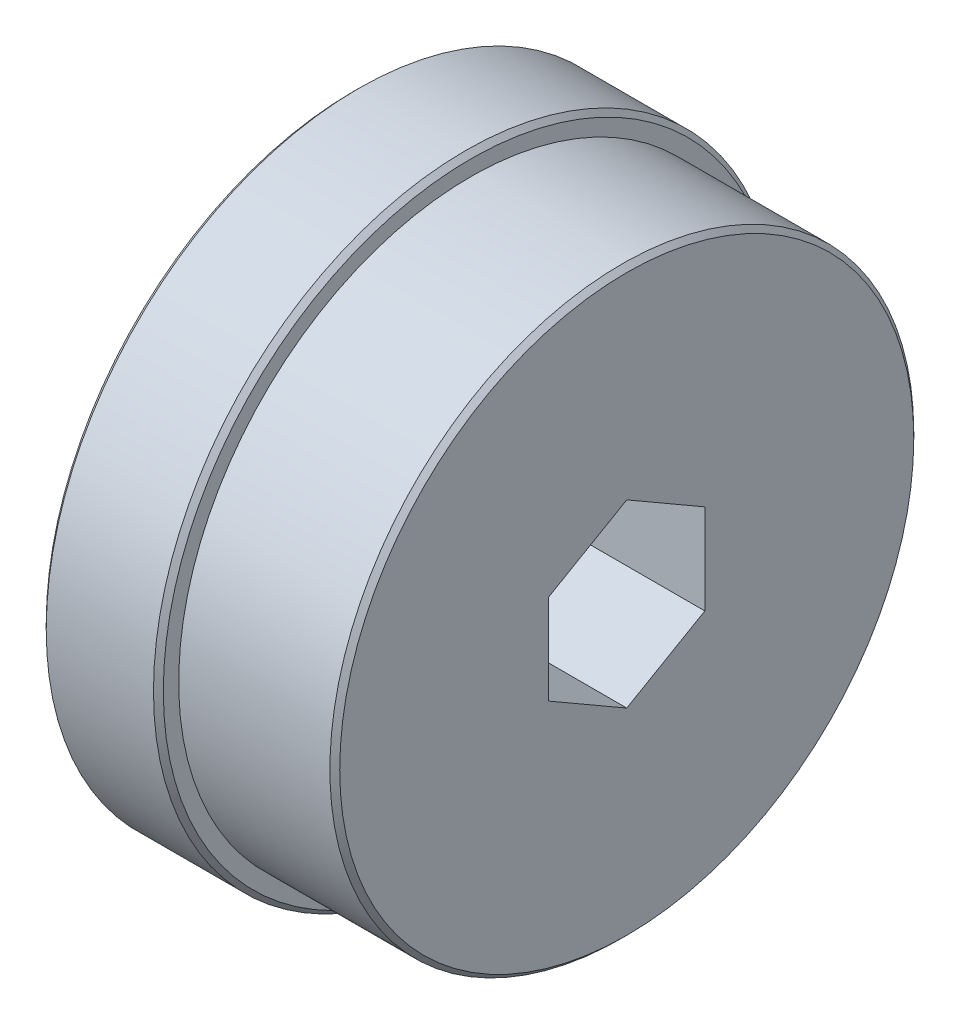
from build123d import *

# Parameters (mm, degrees)
SKETCH1_R           = 23.749
BOSS_EXTRUDE1_DEPTH = 12.7
SKETCH2_R           = 25.4
BOSS_EXTRUDE2_DEPTH = 9.525
CHAMFER1_SIZE       = 0.4
CUT_EXTRUDE1_DEPTH  = 43.240627659


with BuildPart() as part:
    # Sketch1 → Boss-Extrude1 (new body)
    with BuildSketch(Plane(origin=(0, 0, 0), x_dir=(0, 0, -1), z_dir=(1, 0, 0))):
        Circle(SKETCH1_R)
    extrude(amount=BOSS_EXTRUDE1_DEPTH)

    # Sketch2 → Boss-Extrude2 (add)
    with BuildSketch(Plane.ZY):
        Circle(SKETCH2_R)
    extrude(amount=BOSS_EXTRUDE2_DEPTH)

    # Chamfer1
    chamfer1_edges = [part.edges().sort_by_distance(p)[0] for p in [
        (12.7, 0, 23.749),
        (-9.525, 0, -25.4),
        (0, 0, -25.4),
    ]]
    chamfer(chamfer1_edges, length=CHAMFER1_SIZE)

    # Sketch4 → Cut-Extrude1 (cut, through all)
    with BuildSketch(Plane.ZY.offset(9.525)):
        Polygon((0, 7.332348419), (-6.35, 3.666174209), (-6.35, -3.666174209), (0, -7.332348419), (6.35, -3.666174209), (6.35, 3.666174209), align=None)
    extrude(amount=-CUT_EXTRUDE1_DEPTH, mode=Mode.SUBTRACT)


solid = part.part
